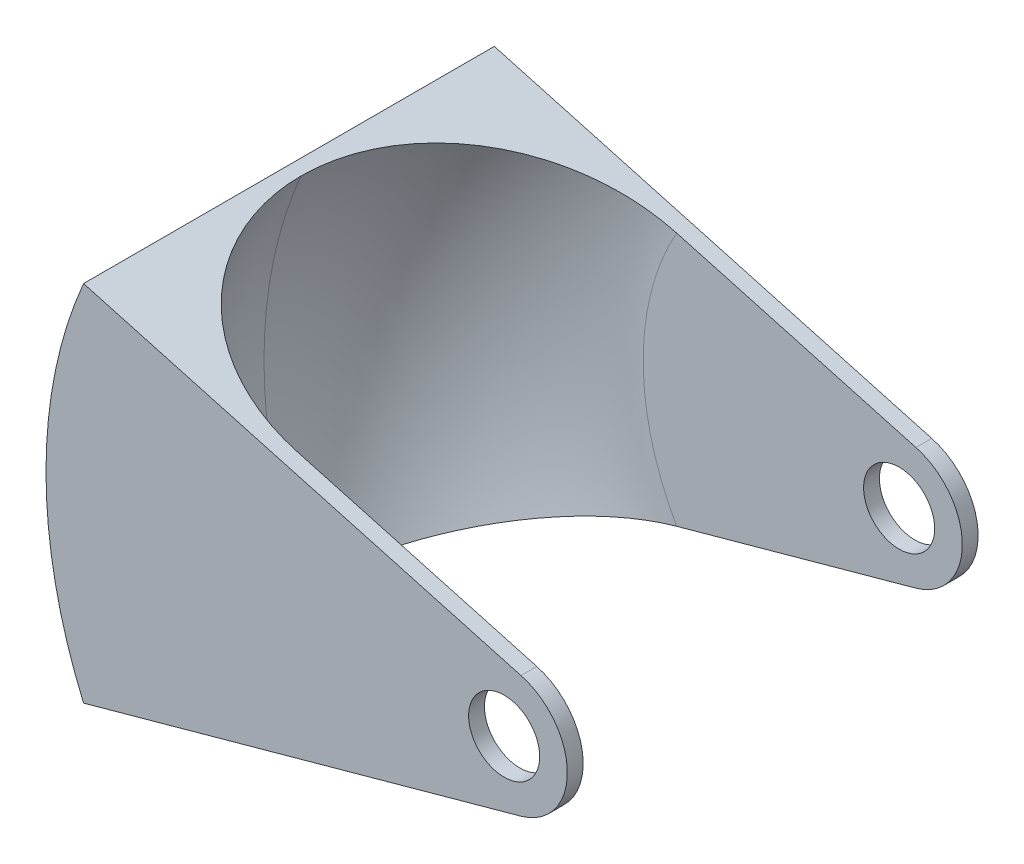
from build123d import *

# Parameters (mm, degrees)
SKETCH1_R               = 14.287500000000001
BOSS_EXTRUDE1_DEPTH     = 165.1
CUT_EXTRUDE1_DEPTH      = 258.8795903614708
CUT_EXTRUDE1_DEPTH_BACK = 258.8795903614708
BOSS_EXTRUDE2_DEPTH     = 152.4
FILLET2_R               = 76.2


with BuildPart() as part:
    # Sketch1 → Boss-Extrude1 (new body)
    with BuildSketch(Plane.XY):
        with BuildLine():
            Line((6.759931115856893, 24.483940273347972), (-169.05197980207154, 73.02499999999999))
            ThreePointArc((-169.05197980207154, 73.02499999999999), (-184.15, 2.255e-14), (-169.05197980207154, -73.02499999999999))
            Line((-169.05197980207154, -73.02499999999999), (6.759931115856893, -24.483940273347972))
            ThreePointArc((6.759931115856893, -24.483940273347972), (25.40000000000002, 0), (6.759931115856893, 24.483940273347972))
        make_face()
        Circle(SKETCH1_R, mode=Mode.SUBTRACT)
    extrude(amount=-BOSS_EXTRUDE1_DEPTH)

    # Sketch2 → Cut-Extrude1 (cut, two sides: drawn at the far end of the back side and taken through both)
    with BuildSketch(Plane(origin=(0, 0, 0), x_dir=(1, 0, 0), z_dir=(0, 1, 0)).offset(-CUT_EXTRUDE1_DEPTH_BACK)):
        Polygon((-184.15, 158.75), (25.400000000000006, 158.75), (25.39999999999999, 6.35), (-184.14999999999998, 6.349999999999994), align=None)
    extrude(amount=CUT_EXTRUDE1_DEPTH + CUT_EXTRUDE1_DEPTH_BACK, mode=Mode.SUBTRACT)


with BuildPart() as cut_extrude1_piece_1:
    # of the separate pieces the step leaves, piece 1, a body of its own (cut_extrude1_pieces)
    add(part.part.solids().sort_by_distance((-169.051979802, -73.025, 0))[0])



with BuildPart() as cut_extrude1_piece_2:
    # of the separate pieces the step leaves, piece 2, a body of its own (cut_extrude1_pieces)
    add(part.part.solids().sort_by_distance((-169.051979802, -73.025, -158.75))[0])


with BuildPart() as cut_extrude1_piece_1_1:
    add(cut_extrude1_piece_1.part)

    add(cut_extrude1_piece_2.part)  # Boss-Extrude2 merges Cut-Extrude1 piece 2
    # Sketch3 → Boss-Extrude2 (add)
    with BuildSketch(Plane.XY.offset(-158.75)):
        with BuildLine():
            Line((-169.05197980207154, 73.02499999999999), (-164.155191747402, 71.67301377682864))
            ThreePointArc((-164.155191747402, 71.67301377682864), (-179.07, 3.242e-14), (-164.15519174740194, -71.67301377682858))
            Line((-164.15519174740194, -71.67301377682858), (-169.05197980207154, -73.02499999999998))
            ThreePointArc((-169.05197980207154, -73.02499999999998), (-184.15, 1.0433e-13), (-169.05197980207154, 73.02499999999999))
        make_face()
    extrude(amount=BOSS_EXTRUDE2_DEPTH)

    # Fillet2
    fillet2_edges = [cut_extrude1_piece_1_1.edges().sort_by_distance(p)[0] for p in [
        (-179.06999999999994, 1.066e-14, -6.349999999999994),
        (-179.06999999999994, 1.066e-14, -158.75),
    ]]
    fillet(fillet2_edges, radius=FILLET2_R - 0.0001)  # a hair under: the kernel refuses the full size


solid = cut_extrude1_piece_1_1.part
